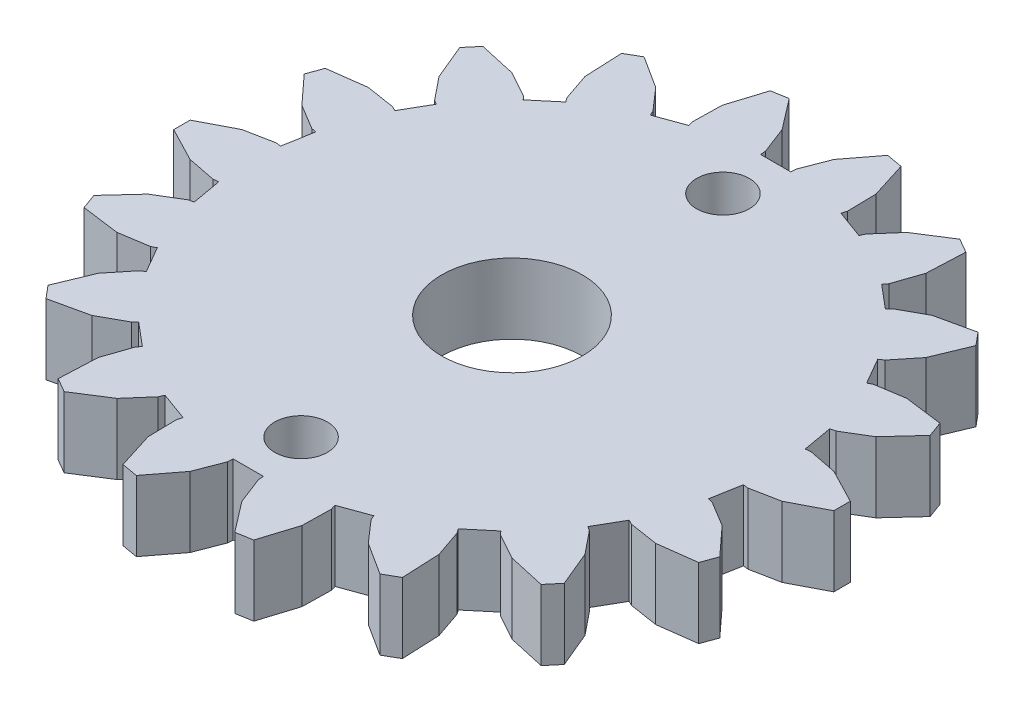
from build123d import *

# Parameters (mm, degrees)
BOSS_EXTRUDE1_DEPTH = 4
CUT_EXTRUDE1_REACH  = 57.513
SKETCH3_R           = 4
SKETCH3_R_2         = 1.5


with BuildPart() as part:
    # Sketch2 → Boss-Extrude1 (new body)
    with BuildSketch(Plane(origin=(0, 0, 0), x_dir=(1, 0, 0), z_dir=(0, 1, 0))):
        Polygon((35.881301999, 21.746845843), (36.173655673, 21.781214444), (37.798266967, 21.462457398), (39.734702842, 20.456921006), (39.734702842, 19.521744655), (37.798266967, 18.516208264), (36.173655673, 18.197451218), (35.881301999, 18.231819819), (35.582458546, 16.537439082), (35.86905938, 16.469734641), (37.286574736, 15.614652215), (38.76250229, 14.007298916), (38.442565616, 13.128468716), (36.278825956, 12.845997884), (34.643299058, 13.102065343), (34.380299133, 13.234376462), (33.520054466, 11.744288677), (33.766091695, 11.58277172), (34.805701389, 10.294322332), (35.642935222, 8.279266936), (35.041707866, 7.562691679), (32.911747255, 8.037360231), (31.462517851, 8.83727561), (31.260584677, 9.051599314), (29.942486765, 7.945612717), (30.118607164, 7.709605717), (30.654784632, 6.143405575), (30.752284986, 3.96358807), (29.942339377, 3.495852506), (28.10310908, 4.670281008), (27.014823165, 5.917724104), (26.898441979, 6.188247093), (25.281648002, 5.599705043), (25.366315662, 5.317676898), (25.334454749, 3.662532228), (24.680568557, 1.580805151), (23.759404527, 1.41840282), (22.432899223, 3.150839997), (21.836982019, 4.695356843), (21.8200188, 4.989332831), (20.099529466, 4.989332831), (20.08256677, 4.695356843), (19.486649566, 3.150839997), (18.160144262, 1.41840282), (17.238980232, 1.580805151), (16.58509404, 3.662532228), (16.553233127, 5.317676898), (16.637900264, 5.599705043), (15.021106287, 6.188247093), (14.904725624, 5.917724104), (13.816439709, 4.670281008), (11.977209412, 3.495852506), (11.167263281, 3.96358807), (11.264763634, 6.143405575), (11.800941625, 7.709605717), (11.977061501, 7.945612717), (10.658964112, 9.051599314), (10.457030415, 8.83727561), (9.007801534, 8.037360231), (6.8778404, 7.562691679), (6.276613044, 8.279266936), (7.1138474, 10.294322332), (8.153457094, 11.58277172), (8.399494323, 11.744288677), (7.539249656, 13.234376462), (7.276249208, 13.102065343), (5.64072231, 12.845997884), (3.476983173, 13.128468716), (3.157046499, 14.007298916), (4.63297353, 15.614652215), (6.050489409, 16.469734641), (6.337090243, 16.537439082), (6.038246267, 18.231819819), (5.745893116, 18.197451218), (4.121281299, 18.516208264), (2.184845947, 19.521744655), (2.184845947, 20.456921006), (4.121281299, 21.462457398), (5.745893116, 21.781214444), (6.038246267, 21.746845843), (6.337090243, 23.44122658), (6.050489409, 23.508931021), (4.63297353, 24.364013447), (3.157046499, 25.971366746), (3.476983173, 26.850196946), (5.64072231, 27.132667778), (7.276249208, 26.876600319), (7.539249656, 26.7442892), (8.399494323, 28.234376985), (8.153457094, 28.395893942), (7.1138474, 29.68434333), (6.276613044, 31.699398726), (6.8778404, 32.415973983), (9.007801534, 31.941305431), (10.457030415, 31.141390052), (10.658964112, 30.927066348), (11.977061501, 32.033052945), (11.800941625, 32.269059945), (11.264763634, 33.835260087), (11.167263281, 36.015077592), (11.977209412, 36.482813156), (13.816439709, 35.308384654), (14.904725624, 34.060941558), (15.021106287, 33.790418569), (16.637900264, 34.378960619), (16.553233127, 34.660988764), (16.58509404, 36.316133434), (17.238980232, 38.39786051), (18.160144262, 38.560262841), (19.486649566, 36.827825665), (20.08256677, 35.283308819), (20.099529466, 34.989332831), (21.8200188, 34.989332831), (21.836982019, 35.283308819), (22.432899223, 36.827825665), (23.759404527, 38.560262841), (24.680568557, 38.39786051), (25.334454749, 36.316133434), (25.366315662, 34.660988764), (25.281648002, 34.378960619), (26.898441979, 33.790418569), (27.014823165, 34.060941558), (28.10310908, 35.308384654), (29.942339377, 36.482813156), (30.752284986, 36.015077592), (30.654784632, 33.835260087), (30.118607164, 32.269059945), (29.942486765, 32.033052945), (31.260584677, 30.927066348), (31.462517851, 31.141390052), (32.911747255, 31.941305431), (35.041707866, 32.415973983), (35.642935222, 31.699398726), (34.805701389, 29.68434333), (33.766091695, 28.395893942), (33.520054466, 28.234376985), (34.380299133, 26.7442892), (34.643299058, 26.876600319), (36.278825956, 27.132667778), (38.442565616, 26.850196946), (38.76250229, 25.971366746), (37.286574736, 24.364013447), (35.86905938, 23.508931021), (35.582458546, 23.44122658), align=None)
    extrude(amount=BOSS_EXTRUDE1_DEPTH)

    # Sketch3 → Cut-Extrude1 (cut, up to next)
    with BuildSketch(Plane(origin=(0, 0, 0), x_dir=(1, 0, 0), z_dir=(0, 1, 0)), mode=Mode.PRIVATE) as cut_extrude1_sk1:
        with Locations((20.959774133, 19.989332831)):
            Circle(SKETCH3_R)
    cut_extrude1_tool1 = extrude(cut_extrude1_sk1.sketch, amount=CUT_EXTRUDE1_REACH, mode=Mode.PRIVATE) & part.part
    # Sketch3 → Cut-Extrude1 (cut, up to next)
    with BuildSketch(Plane(origin=(0, 0, 0), x_dir=(1, 0, 0), z_dir=(0, 1, 0)), mode=Mode.PRIVATE) as cut_extrude1_sk2:
        with Locations((20.959774133, 31.989332831)):
            Circle(SKETCH3_R_2)
    cut_extrude1_tool2 = extrude(cut_extrude1_sk2.sketch, amount=CUT_EXTRUDE1_REACH, mode=Mode.PRIVATE) & part.part
    # Sketch3 → Cut-Extrude1 (cut, up to next)
    with BuildSketch(Plane(origin=(0, 0, 0), x_dir=(1, 0, 0), z_dir=(0, 1, 0)), mode=Mode.PRIVATE) as cut_extrude1_sk3:
        with Locations((20.959774133, 7.989332831)):
            Circle(SKETCH3_R_2)
    cut_extrude1_tool3 = extrude(cut_extrude1_sk3.sketch, amount=CUT_EXTRUDE1_REACH, mode=Mode.PRIVATE) & part.part
    add(cut_extrude1_tool1.solids().sort_by_distance((20.959774, 0, -19.989333))[0], mode=Mode.SUBTRACT)
    add(cut_extrude1_tool2.solids().sort_by_distance((20.959774, 0, -31.989333))[0], mode=Mode.SUBTRACT)
    add(cut_extrude1_tool3.solids().sort_by_distance((20.959774, 0, -7.989333))[0], mode=Mode.SUBTRACT)


solid = part.part
